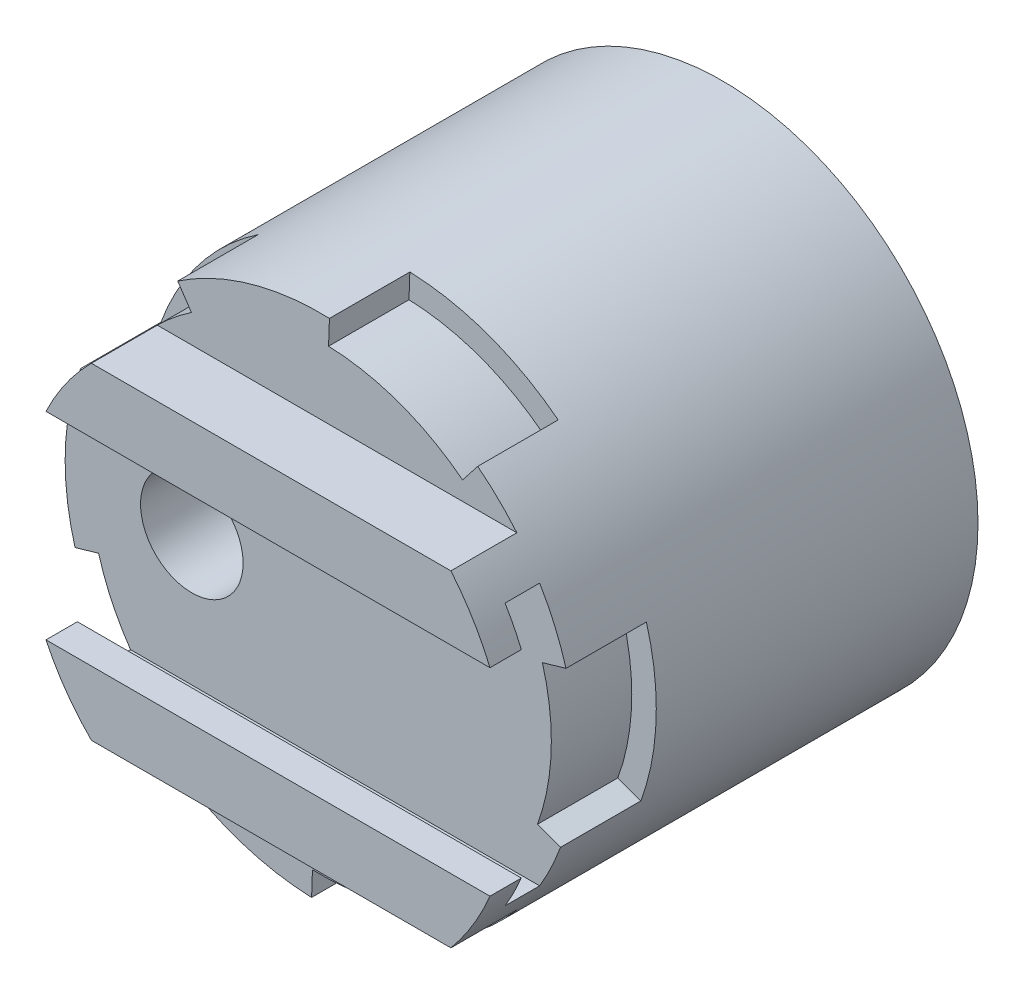
from build123d import *

# Parameters (mm, degrees)
SKETCH1_R           = 28.7
BOSS_EXTRUDE1_DEPTH = 50
SKETCH1_3_R         = 31.75
SKETCH1_3_R_2       = 28.7
BOSS_EXTRUDE2_DEPTH = 40
SKETCH3_R           = 6.375
CUT_EXTRUDE1_DEPTH  = 50
SKETCH3_3_R         = 15.5
SKETCH3_3_R_2       = 6.375
CUT_EXTRUDE2_DEPTH  = 25
BOSS_EXTRUDE3_START = -10
BOSS_EXTRUDE3_DEPTH = 10
BOSS_EXTRUDE4_DEPTH = 30
SKETCH7_OUTSIDE_W   = 86.902
SKETCH7_OUTSIDE_H   = 86.902
CUT_EXTRUDE3_DEPTH  = 68.202120502


# Read off the part's stored shape, not the designer's step: Boss-Extrude3
with BuildPart() as part:
    # Sketch1 → Boss-Extrude1 (new body)
    with BuildSketch(Plane.XY):
        Circle(SKETCH1_R)
    extrude(amount=BOSS_EXTRUDE1_DEPTH)

    # Sketch1<3> → Boss-Extrude2 (add)
    with BuildSketch(Plane.XY):
        Circle(SKETCH1_3_R)
        Circle(SKETCH1_3_R_2, mode=Mode.SUBTRACT)
    extrude(amount=BOSS_EXTRUDE2_DEPTH)

    # Sketch3 → Cut-Extrude1 (cut)
    with BuildSketch(Plane(origin=(0, 0, 0), x_dir=(-1, 0, 0), z_dir=(0, 0, -1))):
        with Locations((16, 0)):
            Circle(SKETCH3_R)
    extrude(amount=-CUT_EXTRUDE1_DEPTH, mode=Mode.SUBTRACT)

    # Sketch3<3> → Cut-Extrude2 (cut)
    with BuildSketch(Plane(origin=(0, 0, 0), x_dir=(-1, 0, 0), z_dir=(0, 0, -1))):
        with Locations((16, 0)):
            Circle(SKETCH3_3_R)
        with Locations(Location((16, 0, 0), (0, 0, 180))):
            Circle(SKETCH3_3_R_2, mode=Mode.SUBTRACT)
    extrude(amount=-CUT_EXTRUDE2_DEPTH, mode=Mode.SUBTRACT)

    # Boss-Extrude3 outline → Boss-Extrude3 (add)
    with BuildSketch(Plane.XY.offset(50).offset(BOSS_EXTRUDE3_START)):
        with BuildLine():
            Line((-30.520058846, -8.751486047), (-27.588210673, -7.910792112))
            ThreePointArc((-27.588210673, -7.910792112), (-28.682516735, 1.001615555), (-26.969178217, 9.815978113))
            Line((-26.969178217, 9.815978113), (-29.83524071, 10.859139551))
            ThreePointArc((-29.83524071, 10.859139551), (-31.730658758, 1.108059021), (-30.520058846, -8.751486047))
        make_face()
        with BuildLine():
            ThreePointArc((-1.001615555, -28.682516735), (-9.815978113, -26.969178217), (-17.669484342, -22.615908629))
            Line((-17.669484342, -22.615908629), (-19.547251842, -25.019341427))
            ThreePointArc((-19.547251842, -25.019341427), (-10.859139551, -29.83524071), (-1.10805902, -31.730658758))
            Line((-1.10805902, -31.730658758), (-1.001615555, -28.682516735))
        make_face()
        with BuildLine():
            Line((-17.754374685, 26.321942929), (-16.04883633, 23.793378332))
            ThreePointArc((-16.04883633, 23.793378332), (-7.910792112, 27.588210673), (1.001615555, 28.682516735))
            Line((1.001615555, 28.682516735), (1.10805902, 31.730658758))
            ThreePointArc((1.10805902, 31.730658758), (-8.751486047, 30.520058846), (-17.754374685, 26.321942929))
        make_face()
        with BuildLine():
            ThreePointArc((26.969178217, -9.815978113), (22.615908629, -17.669484341), (16.04883633, -23.793378332))
            Line((16.04883633, -23.793378332), (17.754374685, -26.321942929))
            ThreePointArc((17.754374685, -26.321942929), (25.019341427, -19.547251842), (29.83524071, -10.859139551))
            Line((29.83524071, -10.859139551), (26.969178217, -9.815978113))
        make_face()
        with BuildLine():
            Line((19.547251842, 25.019341427), (17.669484342, 22.615908629))
            ThreePointArc((17.669484342, 22.615908629), (23.793378332, 16.04883633), (27.588210673, 7.910792112))
            Line((27.588210673, 7.910792112), (30.520058846, 8.751486047))
            ThreePointArc((30.520058846, 8.751486047), (26.321942929, 17.754374685), (19.547251842, 25.019341427))
        make_face()
    extrude(amount=BOSS_EXTRUDE3_DEPTH)

    # Sketch5 → Boss-Extrude4 (add, symmetric)
    with BuildSketch(Plane(origin=(0, 0, 0), x_dir=(0, 0, -1), z_dir=(1, 0, 0))):
        Polygon((-58.2, -12.3), (-54.3, -12.3), (-54.3, -16.3), (-50, -16.3), (-50, -20.3), (-58.2, -20.3), align=None)
    boss_extrude4 = extrude(amount=BOSS_EXTRUDE4_DEPTH, both=True)

    # Mirror1: Boss-Extrude4 across plane
    add(boss_extrude4.mirror(Plane.ZX))

    # Sketch7 outside → Cut-Extrude3 (cut, through all)
    with BuildSketch(Plane.XY.offset(50)):
        Rectangle(SKETCH7_OUTSIDE_W, SKETCH7_OUTSIDE_H)
        with BuildLine():
            Line((-17.669484342, -22.615908629), (-19.547251842, -25.019341427))
            ThreePointArc((-19.547251842, -25.019341427), (-10.859139551, -29.83524071), (-1.10805902, -31.730658758))
            Line((-1.10805902, -31.730658758), (-1.001615555, -28.682516735))
            ThreePointArc((-1.001615555, -28.682516735), (7.910792112, -27.588210673), (16.04883633, -23.793378332))
            Line((16.04883633, -23.793378332), (17.754374685, -26.321942929))
            ThreePointArc((17.754374685, -26.321942929), (25.019341427, -19.547251842), (29.83524071, -10.859139551))
            Line((29.83524071, -10.859139551), (26.969178217, -9.815978113))
            ThreePointArc((26.969178217, -9.815978113), (28.682516735, -1.001615555), (27.588210673, 7.910792112))
            Line((27.588210673, 7.910792112), (30.520058846, 8.751486047))
            ThreePointArc((30.520058846, 8.751486047), (26.321942929, 17.754374685), (19.547251842, 25.019341427))
            Line((19.547251842, 25.019341427), (17.669484342, 22.615908629))
            ThreePointArc((17.669484342, 22.615908629), (9.815978113, 26.969178217), (1.001615555, 28.682516735))
            Line((1.001615555, 28.682516735), (1.10805902, 31.730658758))
            ThreePointArc((1.10805902, 31.730658758), (-8.751486047, 30.520058846), (-17.754374685, 26.321942929))
            Line((-17.754374685, 26.321942929), (-16.04883633, 23.793378332))
            ThreePointArc((-16.04883633, 23.793378332), (-22.615908629, 17.669484342), (-26.969178217, 9.815978113))
            Line((-26.969178217, 9.815978113), (-29.83524071, 10.859139551))
            ThreePointArc((-29.83524071, 10.859139551), (-31.730658758, 1.10805902), (-30.520058846, -8.751486047))
            Line((-30.520058846, -8.751486047), (-27.588210673, -7.910792112))
            ThreePointArc((-27.588210673, -7.910792112), (-23.793378332, -16.04883633), (-17.669484342, -22.615908629))
        make_face(mode=Mode.SUBTRACT)
    extrude(amount=CUT_EXTRUDE3_DEPTH, mode=Mode.SUBTRACT)


solid = part.part
